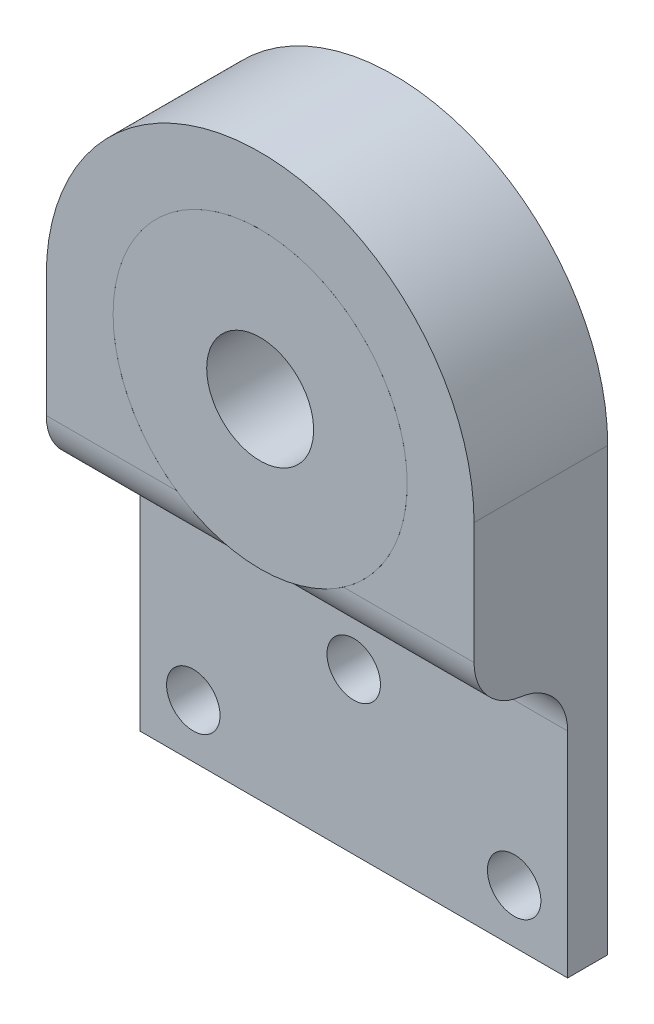
from build123d import *

# Parameters (mm, degrees)
SKETCH1_R           = 11
BOSS_EXTRUDE1_DEPTH = 10
SKETCH2_R           = 11
SKETCH2_R_2         = 4
BOSS_EXTRUDE2_DEPTH = 10
SKETCH3_W           = 32
SKETCH3_H           = 20
SKETCH3_R           = 2
BOSS_EXTRUDE3_DEPTH = 3
FILLET2_R           = 4
FILLET3_R           = 4
SKETCH5_R           = 13
SKETCH5_R_2         = 9
BOSS_EXTRUDE5_DEPTH = 1


with BuildPart() as part:
    # Sketch1 → Boss-Extrude1 (new body)
    with BuildSketch(Plane.XY):
        with BuildLine():
            Line((-16, 0), (-16, -13))
            Line((-16, -13), (16, -13))
            Line((16, -13), (16, 0))
            ThreePointArc((16, 0), (0, 16), (-16, 0))
        make_face()
        Circle(SKETCH1_R, mode=Mode.SUBTRACT)
    extrude(amount=BOSS_EXTRUDE1_DEPTH)

    # Sketch3 → Boss-Extrude3 (add)
    with BuildSketch(Plane(origin=(0, 0, 0), x_dir=(-1, 0, 0), z_dir=(0, 0, -1))):
        with Locations((0, -23)):
            Rectangle(SKETCH3_W, SKETCH3_H)
        with Locations((0, -21)):
            Circle(SKETCH3_R, mode=Mode.SUBTRACT)
        with Locations((12, -29)):
            Circle(SKETCH3_R, mode=Mode.SUBTRACT)
        with Locations((-12, -29)):
            Circle(SKETCH3_R, mode=Mode.SUBTRACT)
    extrude(amount=-BOSS_EXTRUDE3_DEPTH)

    # Fillet2
    fillet2_edges = [part.edges().sort_by_distance(p)[0] for p in [
        (0, -13, 3),
    ]]
    fillet(fillet2_edges, radius=FILLET2_R)

    # Fillet3
    # the kernel refuses this fillet: 4 mm, written as the material it takes off along each edge
    with BuildSketch(Plane(origin=(-25.843134833, -13, 10), x_dir=(0, -0.008963363740973368, -0.9999598282483386), z_dir=(1, 0, 0))) as fillet3_piece_1:
        with BuildLine():
            CenterArc((3.964548274, 3.972949222), FILLET3_R, 180.51356979, 82.819244219)
            Line((-0.035291039, 3.937095767), (-0.43527497, 3.933510421))
            Line((-0.43527497, 3.933510421), (-0.399983931, -0.003585345))
            Line((-0.399983931, -0.003585345), (0.003585345, -0.399983931))
            ThreePointArc((0.003585345, -0.399983931), (3.00346483, -0.37309384), (3.45369984, -0.397294922))
            Line((3.45369984, -0.397294922), (3.500140607, 0))
        make_face()
    extrude(amount=51.686269666, mode=Mode.SUBTRACT)

    # Sketch5 → Boss-Extrude5 (add)
    with BuildSketch(Plane(origin=(0, 0, 0), x_dir=(-1, 0, 0), z_dir=(0, 0, -1))):
        Circle(SKETCH5_R)
        Circle(SKETCH5_R_2, mode=Mode.SUBTRACT)
    extrude(amount=-BOSS_EXTRUDE5_DEPTH)


with BuildPart() as body_2:
    # Sketch2 → Boss-Extrude2 (new body)
    with BuildSketch(Plane(origin=(0, 0, 0), x_dir=(-1, 0, 0), z_dir=(0, 0, -1))):
        Circle(SKETCH2_R)
        Circle(SKETCH2_R_2, mode=Mode.SUBTRACT)
    extrude(amount=-BOSS_EXTRUDE2_DEPTH)


solid = Compound([part.part, body_2.part])
